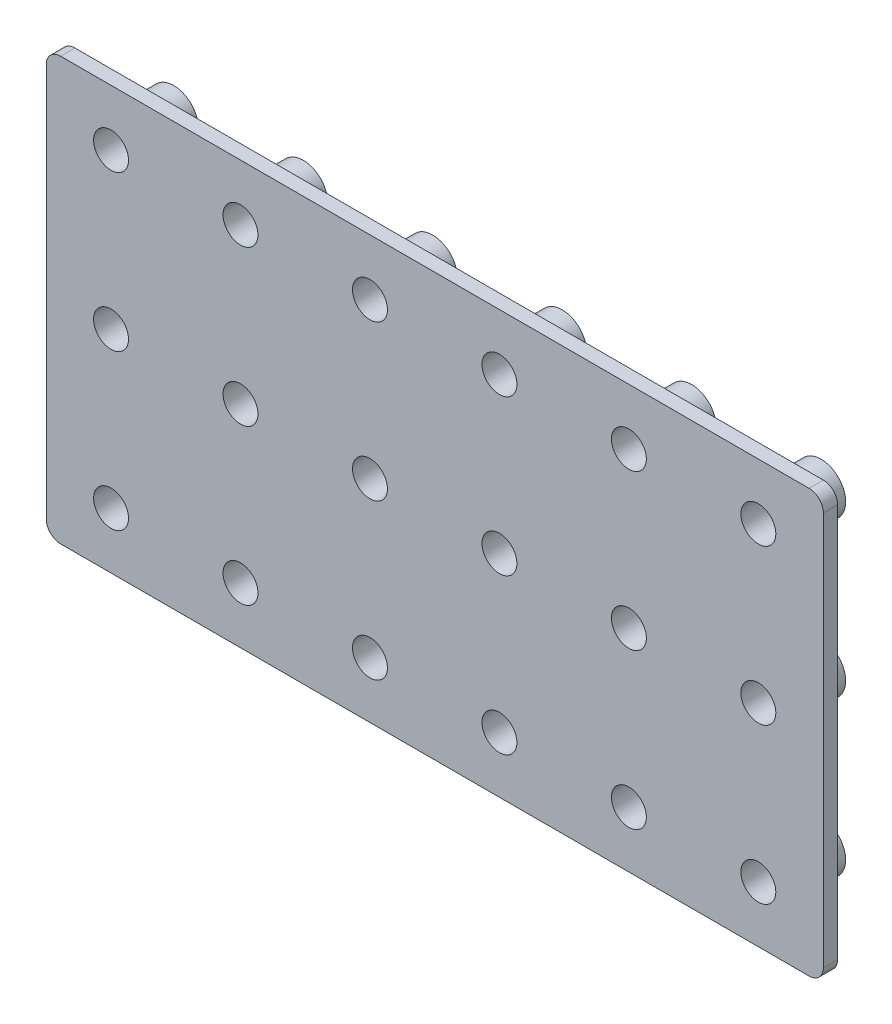
from build123d import *

# Parameters (mm, degrees)
SKETCH1_W           = 109
SKETCH1_H           = 59.25
BOSS_EXTRUDE1_DEPTH = 2
FILLET1_R           = 2
SKETCH7_R           = 3.45
BOSS_EXTRUDE3_DEPTH = 8.8
SKETCH6_R           = 2.45
CUT_EXTRUDE2_DEPTH  = 10


with BuildPart() as part:
    # Sketch1 → Boss-Extrude1 (new body)
    with BuildSketch(Plane.XY):
        with Locations((-68.747210375, 45.363258427)):
            Rectangle(SKETCH1_W, SKETCH1_H)
    extrude(amount=BOSS_EXTRUDE1_DEPTH)

    # Fillet1
    fillet1_edges = [part.edges().sort_by_distance(p)[0] for p in [
        (-123.247210375, 74.988258427, 1),
        (-123.247210375, 15.738258427, 1),
        (-14.247210375, 15.738258427, 1),
        (-14.247210375, 74.988258427, 1),
    ]]
    fillet(fillet1_edges, radius=FILLET1_R)

    # Sketch7 → Boss-Extrude3 (add)
    with BuildSketch(Plane.XY.offset(2)):
        with Locations((-114.167210375, 67.113258427)):
            Circle(SKETCH7_R)
        with Locations((-96.007210375, 67.113258427)):
            Circle(SKETCH7_R)
        with Locations((-77.847210375, 67.113258427)):
            Circle(SKETCH7_R)
        with Locations((-59.687210375, 67.113258427)):
            Circle(SKETCH7_R)
        with Locations((-41.527210375, 67.113258427)):
            Circle(SKETCH7_R)
        with Locations((-23.367210375, 67.113258427)):
            Circle(SKETCH7_R)
        with Locations((-114.167210375, 45.363258427)):
            Circle(SKETCH7_R)
        with Locations((-96.007210375, 45.363258427)):
            Circle(SKETCH7_R)
        with Locations((-77.847210375, 45.363258427)):
            Circle(SKETCH7_R)
        with Locations((-59.687210375, 45.363258427)):
            Circle(SKETCH7_R)
        with Locations((-41.527210375, 45.363258427)):
            Circle(SKETCH7_R)
        with Locations((-23.367210375, 45.363258427)):
            Circle(SKETCH7_R)
        with Locations((-114.167210375, 23.613258427)):
            Circle(SKETCH7_R)
        with Locations((-96.007210375, 23.613258427)):
            Circle(SKETCH7_R)
        with Locations((-77.847210375, 23.613258427)):
            Circle(SKETCH7_R)
        with Locations((-59.687210375, 23.613258427)):
            Circle(SKETCH7_R)
        with Locations((-41.527210375, 23.613258427)):
            Circle(SKETCH7_R)
        with Locations((-23.367210375, 23.613258427)):
            Circle(SKETCH7_R)
    extrude(amount=-BOSS_EXTRUDE3_DEPTH)

    # Sketch6 → Cut-Extrude2 (cut)
    with BuildSketch(Plane.XY.offset(2)):
        with Locations((-114.167210375, 67.113258427)):
            Circle(SKETCH6_R)
        with Locations((-96.007210375, 67.113258427)):
            Circle(SKETCH6_R)
        with Locations((-77.847210375, 67.113258427)):
            Circle(SKETCH6_R)
        with Locations((-59.687210375, 67.113258427)):
            Circle(SKETCH6_R)
        with Locations((-41.527210375, 67.113258427)):
            Circle(SKETCH6_R)
        with Locations((-23.367210375, 67.113258427)):
            Circle(SKETCH6_R)
        with Locations((-114.167210375, 45.363258427)):
            Circle(SKETCH6_R)
        with Locations((-96.007210375, 45.363258427)):
            Circle(SKETCH6_R)
        with Locations((-77.847210375, 45.363258427)):
            Circle(SKETCH6_R)
        with Locations((-59.687210375, 45.363258427)):
            Circle(SKETCH6_R)
        with Locations((-41.527210375, 45.363258427)):
            Circle(SKETCH6_R)
        with Locations((-23.367210375, 45.363258427)):
            Circle(SKETCH6_R)
        with Locations((-114.167210375, 23.613258427)):
            Circle(SKETCH6_R)
        with Locations((-96.007210375, 23.613258427)):
            Circle(SKETCH6_R)
        with Locations((-77.847210375, 23.613258427)):
            Circle(SKETCH6_R)
        with Locations((-59.687210375, 23.613258427)):
            Circle(SKETCH6_R)
        with Locations((-41.527210375, 23.613258427)):
            Circle(SKETCH6_R)
        with Locations((-23.367210375, 23.613258427)):
            Circle(SKETCH6_R)
    extrude(amount=-CUT_EXTRUDE2_DEPTH, mode=Mode.SUBTRACT)


solid = part.part
